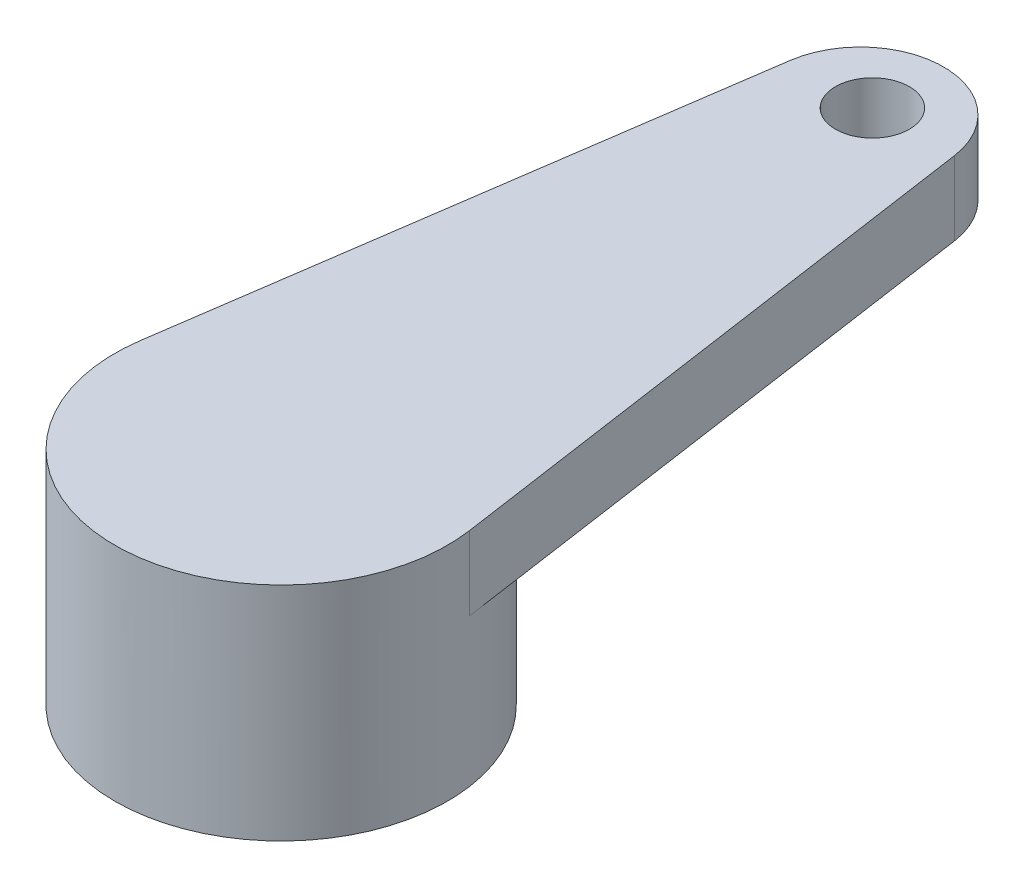
from build123d import *

# Parameters (mm, degrees)
SKETCH1_R           = 4.5
SKETCH1_R_2         = 3
BOSS_EXTRUDE1_DEPTH = 4
SKETCH2_R           = 1
BOSS_EXTRUDE2_DEPTH = 2


with BuildPart() as part:
    # Sketch1 → Boss-Extrude1 (new body)
    with BuildSketch(Plane(origin=(0, 0, 0), x_dir=(1, 0, 0), z_dir=(0, 1, 0))):
        Circle(SKETCH1_R)
        Circle(SKETCH1_R_2, mode=Mode.SUBTRACT)
    extrude(amount=BOSS_EXTRUDE1_DEPTH)

    # Sketch2 → Boss-Extrude2 (add)
    with BuildSketch(Plane(origin=(0, 4, 0), x_dir=(1, 0, 0), z_dir=(0, 1, 0))):
        with BuildLine():
            Line((-4.453412293, 0.645847467), (-2.226706146, 16))
            ThreePointArc((-2.226706146, 16), (0, 17.927076266), (2.226706146, 16))
            Line((2.226706146, 16), (4.453412293, 0.645847467))
            ThreePointArc((4.453412293, 0.645847467), (0, -4.5), (-4.453412293, 0.645847467))
        make_face()
        with Locations((0, 16)):
            Circle(SKETCH2_R, mode=Mode.SUBTRACT)
    extrude(amount=BOSS_EXTRUDE2_DEPTH)


solid = part.part
